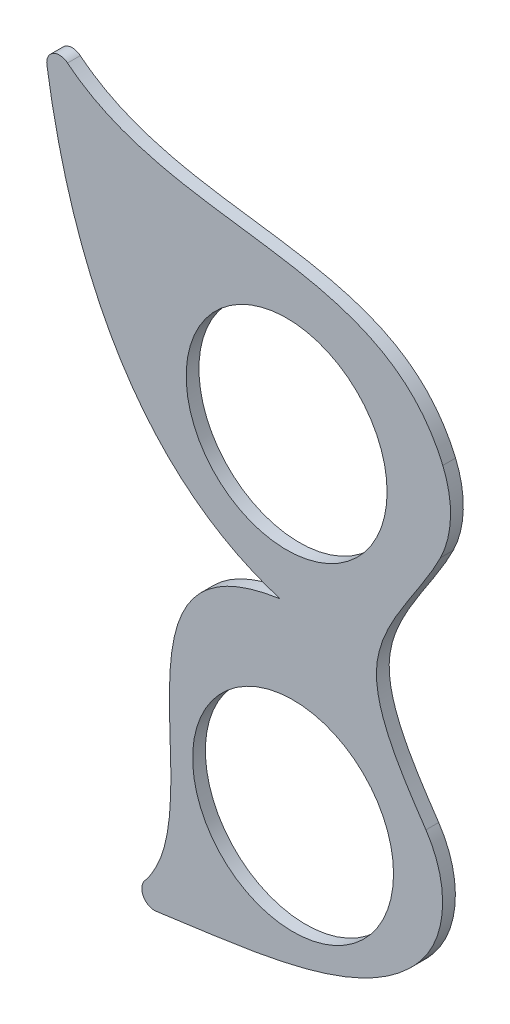
from build123d import *

# Parameters (mm, degrees)
SKETCH_1_R          = 78.74
EXTRUDE_1_DEPTH     = 10
CUT_EXTRUDE_1_DEPTH = 10
FILLET_1_R          = 76.2
FILLET_2_R          = 10
FILLET_3_R          = 10


with BuildPart() as part:
    # 草图1 → 凸台-拉伸1 (new body)
    with BuildSketch(Plane.XY):
        with BuildLine():
            Line((190.267122197, 151.113582673), (190.267122197, -81.890410003))
            add(Edge.make_bspline(
                [(-88.138107542, -245.060353001), (6.779919745, -220.260837552), (192.981953107, -238.762703419), (190.267122197, -81.890410003)],
                knots=[0, 0, 0, 0, 1, 1, 1, 1], degree=3))
            add(Edge.make_bspline(
                [(54.215916802, 24.203627008), (-114.622523085, -0.554759509), (39.783580025, -196.67805819), (-88.138107542, -245.060353001)],
                knots=[0, 0, 0, 0, 1, 1, 1, 1], degree=3))
            add(Edge.make_bspline(
                [(-132.455869838, 325.027225622), (-119.39432206, 206.497464479), (-75.497631539, 64.088986069), (54.215916802, 24.203627008)],
                knots=[0, 0, 0, 0, 1, 1, 1, 1], degree=3))
            add(Edge.make_bspline(
                [(190.267122197, 151.113582673), (155.786794972, 310.396382422), (-48.436146721, 217.1498695), (-132.455869838, 325.027225622)],
                knots=[0, 0, 0, 0, 1, 1, 1, 1], degree=3))
        make_face()
        with Locations((59.33940983, 138.616957424)):
            Circle(SKETCH_1_R, mode=Mode.SUBTRACT)
        with Locations((64.391896117, -118.081850955)):
            Circle(SKETCH_1_R, mode=Mode.SUBTRACT)
    extrude(amount=EXTRUDE_1_DEPTH)

    # 草图2 → 切除-拉伸1 (cut)
    with BuildSketch(Plane.XY.offset(10)):
        with BuildLine():
            Line((188.896265885, -107.393898426), (205.862880188, -98.679704405))
            Line((205.862880188, -98.679704405), (202.340041163, 151.118361081))
            Line((202.340041163, 151.118361081), (190.266087737, 151.118361081))
            add(Edge.make_bspline(
                [(190.266087737, 151.118361081), (188.544384558, 103.276758096), (81.518251938, 21.832470975), (169.063135256, -71.612212638), (188.896265885, -107.393898426)],
                knots=[0, 0, 0, 0, 0.522420241, 1, 1, 1, 1], degree=3))
        make_face()
    extrude(amount=-CUT_EXTRUDE_1_DEPTH, mode=Mode.SUBTRACT)

    # 圆角1
    # the kernel refuses this fillet: 76.2 mm, written as the material it takes off along each edge
    with BuildSketch(Plane(origin=(190.266087737, 151.118361081, 10), x_dir=(-0.2976037870645713, 0.9546894709405909, 0), z_dir=(0, 0, -1))) as fillet_1_piece_1:
        with BuildLine():
            CenterArc((21.08459479, -75.823293684), FILLET_1_R, 84.3004486, 49.308731673)
            Line((-31.473255341, -20.649818267), (-32.524412344, -19.546348759))
            ThreePointArc((-32.524412344, -19.546348759), (-17.715527439, -7.413982661), (-0.50558089, 1.437693974))
            Line((-0.50558089, 1.437693974), (-0.135414126, 1.517972007))
            ThreePointArc((-0.135414126, 1.517972007), (14.320252658, 2.198651547), (28.803517484, 1.516465874))
            Line((28.803517484, 1.516465874), (28.652166059, 0))
        make_face()
    extrude(amount=10, mode=Mode.SUBTRACT)
    with BuildSketch(Plane(origin=(188.896265885, -107.393898426, 10), x_dir=(-0.5384434429536498, 0.8426616514000265, 0), z_dir=(0, 0, -1))) as fillet_1_piece_2:
        with BuildLine():
            CenterArc((35.859681761, -76.174050579), FILLET_1_R, 88.504672545, 73.519289888)
            Line((-36.620666388, -52.657266525), (-38.070273351, -52.186930844))
            ThreePointArc((-38.070273351, -52.186930844), (-23.283431284, -22.804726142), (-0.982229113, 1.1652476))
            Line((-0.982229113, 1.1652476), (-0.095133745, 1.521027801))
            ThreePointArc((-0.095133745, 1.521027801), (18.940917562, 1.917869961), (37.887922563, 1.523481012))
            Line((37.887922563, 1.523481012), (37.848153135, 0))
        make_face()
    extrude(amount=10, mode=Mode.SUBTRACT)

    # 圆角2
    fillet_2_edges = [part.edges().sort_by_distance(p)[0] for p in [
        (-132.455869838, 325.027225622, 5),
    ]]
    fillet(fillet_2_edges, radius=FILLET_2_R)

    # 圆角3
    fillet_3_edges = [part.edges().sort_by_distance(p)[0] for p in [
        (-88.138107542, -245.060353001, 5),
    ]]
    fillet(fillet_3_edges, radius=FILLET_3_R)


solid = part.part
